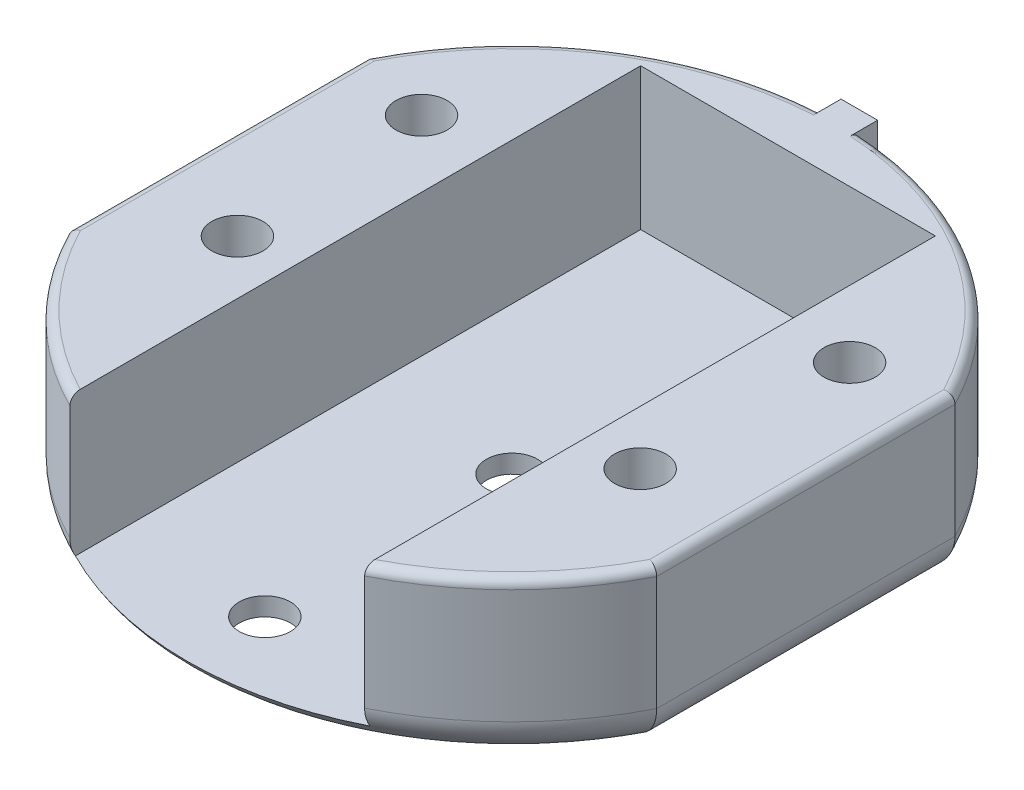
from build123d import *
from build123d.topology import SkipClean

# Parameters (mm, degrees)
BOSS_EXTRUDE1_DEPTH      = 1
BOSS_EXTRUDE2_DEPTH      = 18
BOSS_EXTRUDE2_DEPTH_BACK = 18.972201
SKETCH2_W                = 8
SKETCH2_H                = 7.75
SKETCH3_R                = 59.910539196
CUT_EXTRUDE1_DEPTH       = 28.577289765
CUT_EXTRUDE2_DEPTH       = 28.577289597
CUT_EXTRUDE2_DEPTH_BACK  = 28.577289597
SKETCH5_R                = 1.4
BOSS_EXTRUDE3_DEPTH      = 8.75
CUT_EXTRUDE3_DEPTH       = 28.276489905
FILLET1_R                = 2
FILLET2_R                = 0.5


with BuildPart() as part:
    # Sketch1 → Boss-Extrude1 (new body)
    with BuildSketch(Plane(origin=(0, 0, 0), x_dir=(1, 0, 0), z_dir=(0, 1, 0))):
        with BuildLine():
            Line((-1, 17.972200756), (-1, 18.972200756))
            Line((-1, 18.972200756), (1, 18.972200756))
            Line((1, 18.972200756), (1, 17.972200756))
            ThreePointArc((1, 17.972200756), (0, -18), (-1, 17.972200756))
        make_face()
    extrude(amount=BOSS_EXTRUDE1_DEPTH)

    # Sketch2 → Boss-Extrude2 (add, two sides: drawn at the far end of the back side and taken through both)
    with BuildSketch(Plane.XY.offset(-BOSS_EXTRUDE2_DEPTH_BACK)):
        with Locations((-12.05, 4.875)):
            Rectangle(SKETCH2_W, SKETCH2_H)
        with Locations((12.05, 4.875)):
            Rectangle(SKETCH2_W, SKETCH2_H)
    extrude(amount=BOSS_EXTRUDE2_DEPTH + BOSS_EXTRUDE2_DEPTH_BACK)

    # Sketch3 → Cut-Extrude1 (cut, through all)
    with BuildSketch(Plane.XZ):
        Circle(SKETCH3_R)
        with BuildLine():
            Line((-1, -17.972200756), (-1, -18.972200756))
            Line((-1, -18.972200756), (1, -18.972200756))
            Line((1, -18.972200756), (1, -17.972200756))
            ThreePointArc((1, -17.972200756), (0, 18), (-1, -17.972200756))
        make_face(mode=Mode.SUBTRACT)
    extrude(amount=-CUT_EXTRUDE1_DEPTH, mode=Mode.SUBTRACT)

    # Sketch5 → Cut-Extrude2 (cut, two sides: drawn at the far end of the back side and taken through both)
    with BuildSketch(Plane(origin=(0, 0, 0), x_dir=(1, 0, 0), z_dir=(0, 1, 0)).offset(-CUT_EXTRUDE2_DEPTH_BACK)):
        with Locations(Location((0, 0, 0), (0, 0, 180))):
            Circle(SKETCH5_R)
        with Locations(Location((11, -4, 0), (0, 0, 180))):
            Circle(SKETCH5_R)
        with Locations(Location((-11, -4, 0), (0, 0, 180))):
            Circle(SKETCH5_R)
        with Locations(Location((-11.691342951, 6.75, 0), (0, 0, 180))):
            Circle(SKETCH5_R)
        with Locations(Location((0, -13.5, 0), (0, 0, 180))):
            Circle(SKETCH5_R)
        with Locations(Location((11.691342951, 6.75, 0), (0, 0, 180))):
            Circle(SKETCH5_R)
    extrude(amount=CUT_EXTRUDE2_DEPTH + CUT_EXTRUDE2_DEPTH_BACK, mode=Mode.SUBTRACT)

    # Sketch6 → Boss-Extrude3 (add)
    with SkipClean():  # the faces are left unmerged after this step: merging them gives an invalid solid
        with BuildSketch(Plane.XZ):
            with BuildLine():
                Line((-8.097530488, -15.075758147), (8.097530488, -15.075758147))
                Line((8.097530488, -15.075758147), (8.097530488, -16.075758147))
                ThreePointArc((8.097530488, -16.075758147), (4.646545909, -17.389928439), (1, -17.972200756))
                Line((1, -17.972200756), (1, -18.972200756))
                Line((1, -18.972200756), (-1, -18.972200756))
                Line((-1, -18.972200756), (-1, -17.972200756))
                ThreePointArc((-1, -17.972200756), (-4.646545909, -17.389928439), (-8.097530488, -16.075758147))
                Line((-8.097530488, -16.075758147), (-8.097530488, -15.075758147))
            make_face()
        extrude(amount=-BOSS_EXTRUDE3_DEPTH)
    add(part.part.scale(1), mode=Mode.REPLACE)  # the faces are merged on a copy

    # Sketch7 → Cut-Extrude3 (cut, through all)
    with BuildSketch(Plane(origin=(0, 1, 0), x_dir=(1, 0, 0), z_dir=(0, 1, 0))):
        with BuildLine():
            Line((16.05, 8.148466113), (16.05, -8.148466113))
            ThreePointArc((16.05, -8.148466113), (18, 0), (16.05, 8.148466113))
        make_face()
        with BuildLine():
            Line((-16.05, -8.148466113), (-16.05, 8.148466113))
            ThreePointArc((-16.05, 8.148466113), (-18, 0), (-16.05, -8.148466113))
        make_face()
    extrude(amount=-CUT_EXTRUDE3_DEPTH, mode=Mode.SUBTRACT)

    # Fillet1
    # the kernel refuses this fillet: 2 mm, written as the material it takes off along each edge
    with BuildSketch(Plane(origin=(16.05, 0, 13.148466113), x_dir=(-1, 0, 0), z_dir=(0, 0, -1)), Plane(origin=(-16.05, 0, -13.148466113), x_dir=(1, 0, 0), z_dir=(0, 0, 1))) as fillet1_piece_1:
        with BuildLine():
            CenterArc((FILLET1_R, FILLET1_R), FILLET1_R, 180, 90)
            Line((0, FILLET1_R), (0, 0))
            Line((0, 0), (FILLET1_R, 0))
        make_face()
    extrude(amount=26.296932227, mode=Mode.SUBTRACT)
    with BuildSketch(Plane(origin=(0, 0, 0), x_dir=(0.9816654427410076, 0, 0.19061206291339847), z_dir=(0.19061206291339847, 0, -0.9816654427410076))) as fillet1_piece_2:
        with BuildLine():
            CenterArc((18 - FILLET1_R, -FILLET1_R), FILLET1_R, 0, 90)
            Line((18, -FILLET1_R), (18, 0))
            Line((18, 0), (18 - FILLET1_R, 0))
        make_face()
    revolve(axis=Axis((0, 0, 0), (0, -1, 0)), revolution_arc=158.022988726, mode=Mode.SUBTRACT)
    with BuildSketch(Plane(origin=(0, 0, 0), x_dir=(0.4498628048748618, 0, -0.8930976748318865), z_dir=(-0.8930976748318865, 0, -0.4498628048748618))) as fillet1_piece_3:
        with BuildLine():
            CenterArc((18 - FILLET1_R, -FILLET1_R), FILLET1_R, 0, 90)
            Line((18, -FILLET1_R), (18, 0))
            Line((18, 0), (18 - FILLET1_R, 0))
        make_face()
    revolve(axis=Axis((0, 0, 0), (0, -1, 0)), revolution_arc=52.265087313, mode=Mode.SUBTRACT)
    with BuildSketch(Plane(origin=(0, 0, 0), x_dir=(-0.9816270812345659, 0, -0.19080952121659656), z_dir=(-0.19080952121659656, 0, 0.9816270812345659))) as fillet1_piece_4:
        with BuildLine():
            CenterArc((18 - FILLET1_R, -FILLET1_R), FILLET1_R, 0, 90)
            Line((18 - FILLET1_R, 0), (18, 0))
            Line((18, 0), (18, -FILLET1_R))
        make_face()
    revolve(axis=Axis((0, 0, 0), (0, -1, 0)), revolution_arc=52.265087313, mode=Mode.SUBTRACT)
    with BuildSketch(Plane(origin=(0, 0, 0), x_dir=(-0.44986280487485913, 0, -0.8930976748318878), z_dir=(-0.8930976748318878, 0, 0.44986280487485913))) as fillet1_piece_5_section:
        with BuildLine():
            CenterArc((18 - FILLET1_R, -FILLET1_R), FILLET1_R, 0, 90)
            Line((18 - FILLET1_R, 0), (18, 0))
            Line((18, 0), (18, -FILLET1_R))
        make_face()
    fillet1_piece_5 = revolve(axis=Axis((0, 0, 0), (0, -1, 0)), revolution_arc=39.46607541, mode=Mode.PRIVATE)
    fillet1_piece_5 = split(fillet1_piece_5, bisect_by=Plane(origin=(-1, 0.459921415, -16.842636156), z_dir=(-1, 0, 0)), keep=Keep.TOP, mode=Mode.PRIVATE)
    add(fillet1_piece_5, mode=Mode.SUBTRACT)
    with BuildSketch(Plane(origin=(0, 0, 0), x_dir=(-0.44986280487485913, 0, -0.8930976748318878), z_dir=(-0.8930976748318878, 0, 0.44986280487485913))) as fillet1_piece_6_section:
        with BuildLine():
            CenterArc((18 - FILLET1_R, -FILLET1_R), FILLET1_R, 0, 90)
            Line((18 - FILLET1_R, 0), (18, 0))
            Line((18, 0), (18, -FILLET1_R))
        make_face()
    fillet1_piece_6 = revolve(axis=Axis((0, 0, 0), (0, -1, 0)), revolution_arc=39.46607541, mode=Mode.PRIVATE)
    fillet1_piece_6 = split(fillet1_piece_6, bisect_by=Plane(origin=(1, 0.461212135, -17.370872929), z_dir=(1, 0, 0)), keep=Keep.TOP, mode=Mode.PRIVATE)
    add(fillet1_piece_6, mode=Mode.SUBTRACT)
    with BuildSketch(Plane(origin=(0, 0, 0), x_dir=(-0.22037727986092012, 0, -0.9754147089936167), z_dir=(-0.9754147089936167, 0, 0.22037727986092012))) as fillet1_piece_7_section:
        with BuildLine():
            CenterArc((18 - FILLET1_R, -FILLET1_R), FILLET1_R, 0, 90)
            Line((18, -FILLET1_R), (18, 0))
            Line((18, 0), (18 - FILLET1_R, 0))
        make_face()
    fillet1_piece_7 = revolve(axis=Axis((0, 0, 0), (0, -1, 0)), revolution_arc=39.46607541, mode=Mode.PRIVATE)
    fillet1_piece_7 = split(fillet1_piece_7, bisect_by=Plane(origin=(-1, 0.461212076, -17.370872697), z_dir=(-1, 0, 0)), keep=Keep.TOP, mode=Mode.PRIVATE)
    add(fillet1_piece_7, mode=Mode.SUBTRACT)
    with BuildSketch(Plane(origin=(0, 0, 0), x_dir=(-0.22037727986092012, 0, -0.9754147089936167), z_dir=(-0.9754147089936167, 0, 0.22037727986092012))) as fillet1_piece_8_section:
        with BuildLine():
            CenterArc((18 - FILLET1_R, -FILLET1_R), FILLET1_R, 0, 90)
            Line((18, -FILLET1_R), (18, 0))
            Line((18, 0), (18 - FILLET1_R, 0))
        make_face()
    fillet1_piece_8 = revolve(axis=Axis((0, 0, 0), (0, -1, 0)), revolution_arc=39.46607541, mode=Mode.PRIVATE)
    fillet1_piece_8 = split(fillet1_piece_8, bisect_by=Plane(origin=(1, 0.459921447, -16.842636316), z_dir=(1, 0, 0)), keep=Keep.TOP, mode=Mode.PRIVATE)
    add(fillet1_piece_8, mode=Mode.SUBTRACT)

    # Fillet2
    fillet2_edges = [part.edges().sort_by_distance(p)[0] for p in [
        (16.05, 8.75, 0),
        (-16.05, 8.75, 0),
        (-12.688880148, 8.75, 12.766844582),
        (-12.707725875, 8.75, -12.748086252),
        (12.688880148, 8.75, 12.766844582),
        (12.707725875, 8.75, -12.748086252),
    ]]
    fillet(fillet2_edges, radius=FILLET2_R)


solid = part.part
